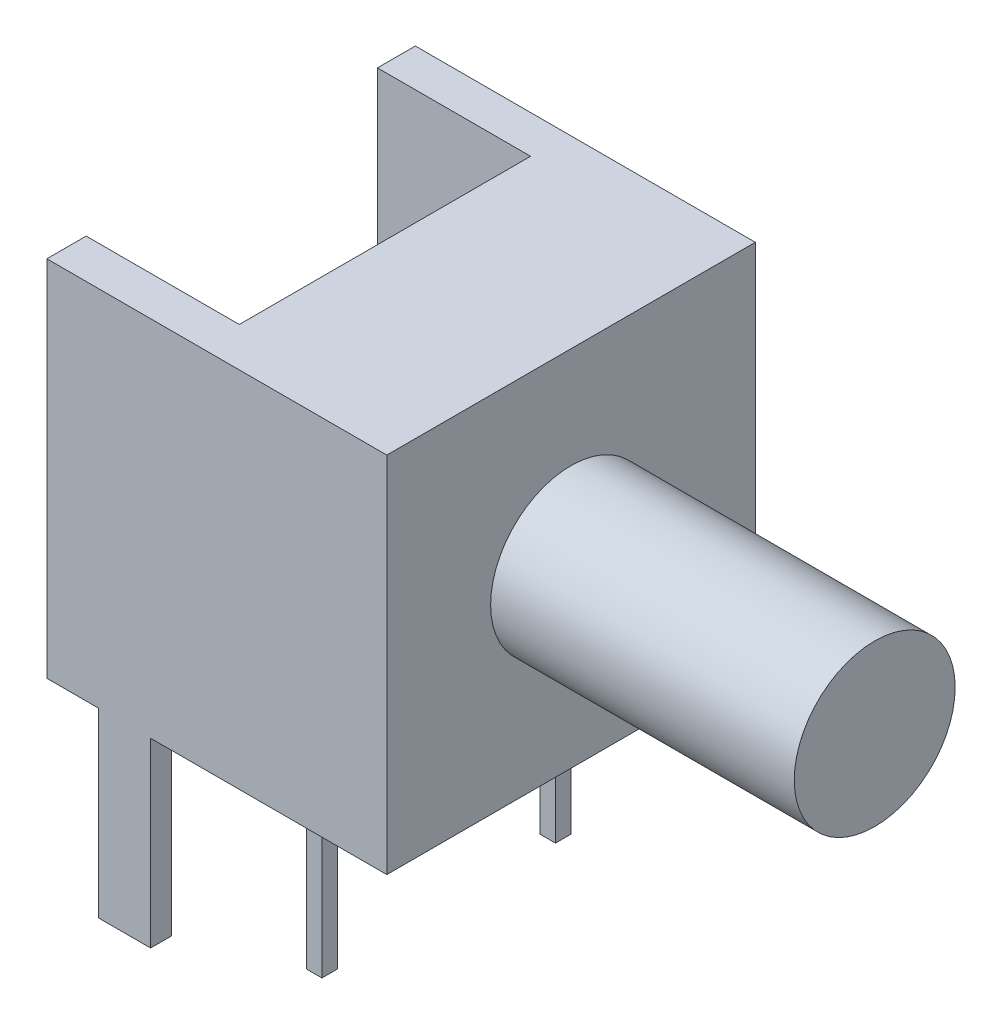
from build123d import *

# Parameters (mm, degrees)
SKETCH1_W           = 7.1
SKETCH1_H           = 7
BOSS_EXTRUDE1_DEPTH = 6.55
SKETCH2_W           = 0.3
SKETCH2_H           = 0.3
SKETCH2_W_2         = 1
SKETCH2_H_2         = 0.4
BOSS_EXTRUDE2_DEPTH = 3.5
SKETCH3_W           = 2.95
SKETCH3_H           = 5.612486488
CUT_EXTRUDE1_DEPTH  = 13.874587372
SKETCH4_R           = 1.55
BOSS_EXTRUDE3_DEPTH = 5.85


with BuildPart() as part:
    # Sketch1 → Boss-Extrude1 (new body)
    with BuildSketch(Plane(origin=(0, 0, 0), x_dir=(0, 0, -1), z_dir=(1, 0, 0))):
        Rectangle(SKETCH1_W, SKETCH1_H)
    extrude(amount=-BOSS_EXTRUDE1_DEPTH)

    # Sketch2 → Boss-Extrude2 (add)
    with BuildSketch(Plane.XZ.offset(3.5)):
        with Locations((-2.55, 2.25)):
            Rectangle(SKETCH2_W, SKETCH2_H)
        with Locations((-5.05, 3.35)):
            Rectangle(SKETCH2_W_2, SKETCH2_H_2)
    boss_extrude2 = extrude(amount=BOSS_EXTRUDE2_DEPTH)

    # Mirror1: Boss-Extrude2 across plane
    add(boss_extrude2.mirror(Plane.XY))

    # Sketch3 → Cut-Extrude1 (cut, through all)
    with BuildSketch(Plane(origin=(0, 3.5, 0), x_dir=(1, 0, 0), z_dir=(0, 1, 0))):
        with Locations((-5.075, 0.013867293)):
            Rectangle(SKETCH3_W, SKETCH3_H)
    extrude(amount=-CUT_EXTRUDE1_DEPTH, mode=Mode.SUBTRACT)

    # Sketch4 → Boss-Extrude3 (add)
    with BuildSketch(Plane(origin=(0, 0, 0), x_dir=(0, 0, -1), z_dir=(1, 0, 0))):
        Circle(SKETCH4_R)
    extrude(amount=BOSS_EXTRUDE3_DEPTH)


solid = part.part
